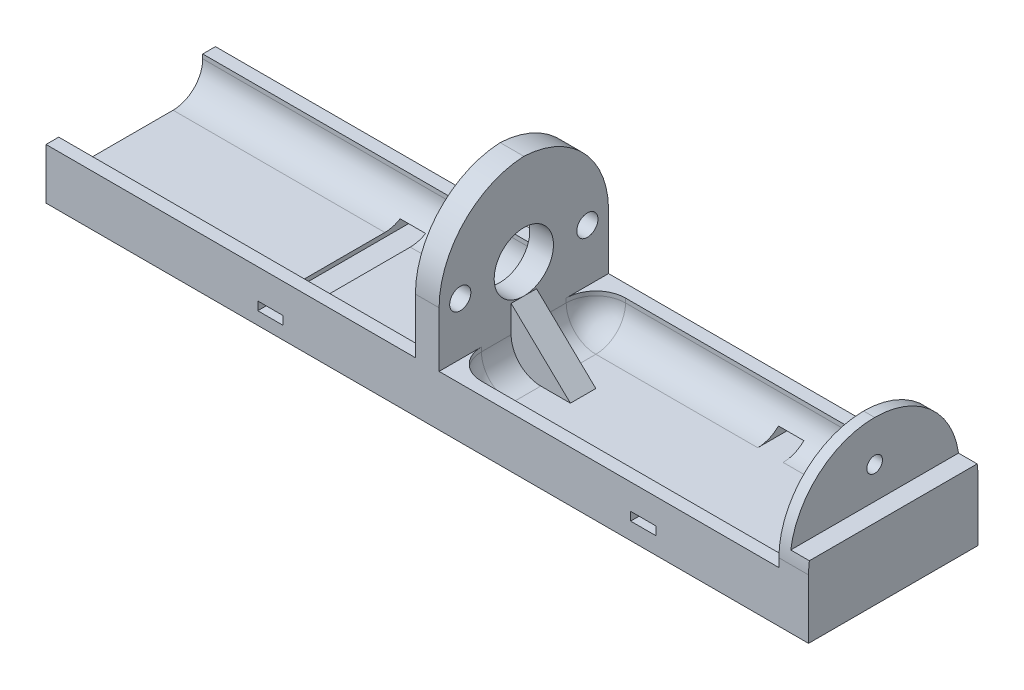
from build123d import *

# Parameters (mm, degrees)
SKETCH1_W                = 20
SKETCH1_H                = 2
BOSS_EXTRUDE1_DEPTH      = 90
SKETCH2_W                = 2.795480737
SKETCH2_H                = 20
BOSS_EXTRUDE2_DEPTH      = 21
SKETCH3_W                = 3.5
SKETCH3_H                = 20
BOSS_EXTRUDE3_DEPTH      = 15
FILLET1_R                = 10.5
FILLET2_R                = 10
BOSS_EXTRUDE4_REACH      = 93.71
SKETCH4_W                = 1.5
SKETCH4_H                = 4
CUT_EXTRUDE1_REACH       = 57.51
SKETCH5_R                = 1.25
SKETCH5_R_2              = 3.5
CUT_EXTRUDE2_REACH       = 93.71
SKETCH6_R                = 0.925
SKETCH7_W                = 20
SKETCH7_H                = 8.6
CUT_EXTRUDE3_DEPTH       = 2.2
FILLET3_R                = 3.5
FILLET4_R                = 3.5
SKETCH8_W                = 3
SKETCH8_H                = 1
ZIPTIEHOLE_DEPTH         = 96.0181678
BOSS_EXTRUDE5_DEPTH      = 1.5
BOSS_EXTRUDE5_DEPTH_BACK = 1.5


# Some blends are built 0.0001 mm under size
with BuildPart() as part:
    # Sketch1 → Boss-Extrude1 (new body)
    with BuildSketch(Plane(origin=(0, 0, 0), x_dir=(0, 0, -1), z_dir=(1, 0, 0))):
        with Locations((10, 1)):
            Rectangle(SKETCH1_W, SKETCH1_H)
    extrude(amount=BOSS_EXTRUDE1_DEPTH)

    # Sketch2 → Boss-Extrude2 (add)
    with BuildSketch(Plane(origin=(0, 2, 0), x_dir=(1, 0, 0), z_dir=(0, 1, 0))):
        with Locations((44.997740369, 10)):
            Rectangle(SKETCH2_W, SKETCH2_H)
    extrude(amount=BOSS_EXTRUDE2_DEPTH)

    # Sketch3 → Boss-Extrude3 (add)
    with BuildSketch(Plane(origin=(0, 2, 0), x_dir=(1, 0, 0), z_dir=(0, 1, 0))):
        with Locations((88.25, 10)):
            Rectangle(SKETCH3_W, SKETCH3_H)
    extrude(amount=BOSS_EXTRUDE3_DEPTH)

    # Fillet1
    # the kernel refuses this fillet: 10.5 mm, written as the material it takes off along each edge
    with BuildSketch(Plane(origin=(72.645480737, 23, 0), x_dir=(0, 0, -1), z_dir=(-1, 0, 0)), Plane(origin=(17.35, 23, -20), x_dir=(0, 0, 1), z_dir=(1, 0, 0))) as fillet1_piece_1:
        with BuildLine():
            CenterArc((FILLET1_R, FILLET1_R), FILLET1_R, 180, 90)
            Line((0, FILLET1_R), (0, 0))
            Line((0, 0), (FILLET1_R, 0))
        make_face()
    extrude(amount=55.295480737, mode=Mode.SUBTRACT)

    # Fillet2
    fillet2_edges = [part.edges().sort_by_distance(p)[0] for p in [
        (88.25, 17, -20),
        (88.25, 17, 0),
    ]]
    fillet(fillet2_edges, radius=FILLET2_R - 0.0001)  # a hair under: the kernel refuses the full size

    # Boss-Extrude4: up to this face of the body (flat: up to its plane)
    boss_extrude4_end = Plane(part.part.faces().sort_by_distance((0, 1, -10))[0])
    # Sketch4 → Boss-Extrude4 (add, up to the picked face)
    with BuildSketch(Plane.ZY.offset(-86.5), mode=Mode.PRIVATE) as boss_extrude4_sk1:
        with Locations((-0.75, 4)):
            Rectangle(SKETCH4_W, SKETCH4_H)
    boss_extrude4_tool1 = split(extrude(boss_extrude4_sk1.sketch, amount=BOSS_EXTRUDE4_REACH, mode=Mode.PRIVATE), bisect_by=boss_extrude4_end, keep=Keep.BOTH, mode=Mode.PRIVATE)
    # Sketch4 → Boss-Extrude4 (add, up to the picked face)
    with BuildSketch(Plane.ZY.offset(-86.5), mode=Mode.PRIVATE) as boss_extrude4_sk2:
        with Locations((-19.25, 4)):
            Rectangle(SKETCH4_W, SKETCH4_H)
    boss_extrude4_tool2 = split(extrude(boss_extrude4_sk2.sketch, amount=BOSS_EXTRUDE4_REACH, mode=Mode.PRIVATE), bisect_by=boss_extrude4_end, keep=Keep.BOTH, mode=Mode.PRIVATE)
    add(boss_extrude4_tool1.solids().sort_by(Axis((86.5, 4, -0.75), (-1, 0, 0)))[0])
    add(boss_extrude4_tool2.solids().sort_by(Axis((86.5, 4, -19.25), (-1, 0, 0)))[0])

    # Sketch5 → Cut-Extrude1 (cut, up to next)
    with BuildSketch(Plane.ZY.offset(-43.6), mode=Mode.PRIVATE) as cut_extrude1_sk1:
        with Locations((-17.5, 12.2)):
            Circle(SKETCH5_R)
    cut_extrude1_tool1 = extrude(cut_extrude1_sk1.sketch, amount=-CUT_EXTRUDE1_REACH, mode=Mode.PRIVATE) & part.part
    # Sketch5 → Cut-Extrude1 (cut, up to next)
    with BuildSketch(Plane.ZY.offset(-43.6), mode=Mode.PRIVATE) as cut_extrude1_sk2:
        with Locations((-2.5, 12.2)):
            Circle(SKETCH5_R)
    cut_extrude1_tool2 = extrude(cut_extrude1_sk2.sketch, amount=-CUT_EXTRUDE1_REACH, mode=Mode.PRIVATE) & part.part
    # Sketch5 → Cut-Extrude1 (cut, up to next)
    with BuildSketch(Plane.ZY.offset(-43.6), mode=Mode.PRIVATE) as cut_extrude1_sk3:
        with Locations((-10, 12.2)):
            Circle(SKETCH5_R_2)
    cut_extrude1_tool3 = extrude(cut_extrude1_sk3.sketch, amount=-CUT_EXTRUDE1_REACH, mode=Mode.PRIVATE) & part.part
    add(cut_extrude1_tool1.solids().sort_by_distance((43.6, 12.2, -17.5))[0], mode=Mode.SUBTRACT)
    add(cut_extrude1_tool2.solids().sort_by_distance((43.6, 12.2, -2.5))[0], mode=Mode.SUBTRACT)
    add(cut_extrude1_tool3.solids().sort_by_distance((43.6, 12.2, -10))[0], mode=Mode.SUBTRACT)

    # Sketch6 → Cut-Extrude2 (cut, up to next)
    with BuildSketch(Plane.ZY.offset(-86.5), mode=Mode.PRIVATE) as cut_extrude2_sk1:
        with Locations((-10, 12.2)):
            Circle(SKETCH6_R)
    cut_extrude2_tool1 = extrude(cut_extrude2_sk1.sketch, amount=-CUT_EXTRUDE2_REACH, mode=Mode.PRIVATE) & part.part
    add(cut_extrude2_tool1.solids().sort_by_distance((86.5, 12.2, -10))[0], mode=Mode.SUBTRACT)

    # Sketch7 → Cut-Extrude3 (cut)
    with BuildSketch(Plane(origin=(90, 0, 0), x_dir=(0, 0, -1), z_dir=(1, 0, 0))):
        with Locations((10, 12.7)):
            Rectangle(SKETCH7_W, SKETCH7_H)
    extrude(amount=-CUT_EXTRUDE3_DEPTH, mode=Mode.SUBTRACT)

    # Fillet3
    fillet3_edges = [part.edges().sort_by_distance(p)[0] for p in [
        (21.8, 2, -1.5),
        (66.447740368, 2, -1.5),
        (66.447740368, 2, -18.5),
        (21.8, 2, -18.5),
    ]]
    fillet(fillet3_edges, radius=FILLET3_R)

    # Fillet4
    fillet4_edges = [part.edges().sort_by_distance(p)[0] for p in [
        (46.395480737, 2, -10),
        (46.395480737, 5.75, -1.5),
        (46.395480737, 3.025126266, -17.474873734),
        (46.395480737, 3.025126266, -2.525126266),
        (46.395480737, 5.75, -18.5),
    ]]
    fillet(fillet4_edges, radius=FILLET4_R)

    # Sketch8 → zipTieHole (cut, through all)
    with BuildSketch(Plane(origin=(0, 0, -20), x_dir=(-1, 0, 0), z_dir=(0, 0, -1))):
        with Locations((-26.4949995, 2)):
            Rectangle(SKETCH8_W, SKETCH8_H)
        with Locations((-70.5, 2.5)):
            Rectangle(SKETCH8_W, SKETCH8_H)
    extrude(amount=-ZIPTIEHOLE_DEPTH, mode=Mode.SUBTRACT)

    # Sketch10 → Boss-Extrude5 (add, two sides: drawn at the far end of the back side and taken through both)
    with BuildSketch(Plane(origin=(46.395480737, 5.5, -10), x_dir=(1, 0, 0), z_dir=(0, 0, 1)).offset(-BOSS_EXTRUDE5_DEPTH_BACK)):
        Polygon((7, -3.5), (0, 3.2), (0, -3.5), align=None)
    extrude(amount=BOSS_EXTRUDE5_DEPTH + BOSS_EXTRUDE5_DEPTH_BACK)


solid = part.part
